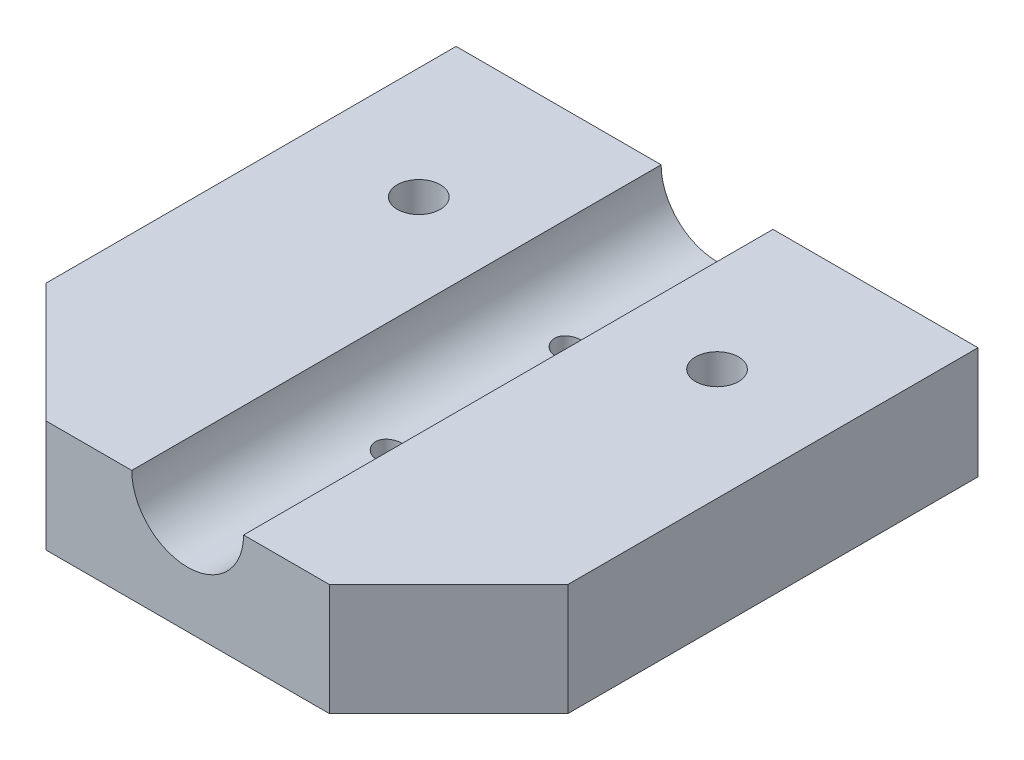
from build123d import *

# Parameters (mm, degrees)
SKETCH1_W                                      = 44.45
SKETCH1_H                                      = 45.085
BOSS_EXTRUDE1_DEPTH                            = 9.525
SKETCH4_R                                      = 4.7625
CUT_EXTRUDE1_DEPTH                             = 52.159881499
MOTORHOLES_D                                   = 2.2606
MOTORHOLES_DEPTH                               = 6.35
MOTORHOLES_TIP                                 = 0.679152758
CBORE_FOR_6_SOCKET_HEAD_CAP_SCREW1_D           = 3.6576
CBORE_FOR_6_SOCKET_HEAD_CAP_SCREW1_CBORE_D     = 7.14502
CBORE_FOR_6_SOCKET_HEAD_CAP_SCREW1_CBORE_DEPTH = 3.5052
CHAMFER1_SIZE                                  = 10.16
F_4_40_TAPPED_HOLE1_D                          = 2.2606


with BuildPart() as part:
    # Sketch1 → Boss-Extrude1 (new body)
    with BuildSketch(Plane(origin=(0, 0, 0), x_dir=(1, 0, 0), z_dir=(0, 1, 0))):
        Rectangle(SKETCH1_W, SKETCH1_H)
    extrude(amount=BOSS_EXTRUDE1_DEPTH)

    # Sketch4 → Cut-Extrude1 (cut, through all)
    with BuildSketch(Plane.XY.offset(22.5425)):
        with Locations((0, 9.525)):
            Circle(SKETCH4_R)
    extrude(amount=-CUT_EXTRUDE1_DEPTH, mode=Mode.SUBTRACT)

    # MotorHoles
    with Locations(Plane(origin=(0, 0, 0), x_dir=(-1, 0, 0), z_dir=(0, -1, 0))):
        with Locations((-5.715, -19.3675), (5.715, -19.3675), (13.081, 19.6469), (-13.081, 19.6469)):
            Hole(MOTORHOLES_D / 2, depth=MOTORHOLES_DEPTH)
            with Locations((0, 0, -(MOTORHOLES_DEPTH + MOTORHOLES_TIP / 2))):  # 118° drill point
                Cone(0, MOTORHOLES_D / 2, MOTORHOLES_TIP, mode=Mode.SUBTRACT)

    # CBORE for #6 Socket Head Cap Screw1 (through all)
    with Locations(Plane(origin=(0, 0, 0), x_dir=(-1, 0, 0), z_dir=(0, -1, 0))):
        with Locations((-12.7, 9.8425), (12.7, 9.8425)):
            CounterBoreHole(CBORE_FOR_6_SOCKET_HEAD_CAP_SCREW1_D / 2, CBORE_FOR_6_SOCKET_HEAD_CAP_SCREW1_CBORE_D / 2, CBORE_FOR_6_SOCKET_HEAD_CAP_SCREW1_CBORE_DEPTH)

    # Chamfer1
    chamfer1_edges = [part.edges().sort_by_distance(p)[0] for p in [
        (22.225, 4.7625, 22.5425),
        (-22.225, 4.7625, 22.5425),
    ]]
    chamfer(chamfer1_edges, length=CHAMFER1_SIZE)

    # #4-40 Tapped Hole1 (through all)
    with Locations(Plane(origin=(0, 0, 0), x_dir=(-1, 0, 0), z_dir=(0, -1, 0))):
        with Locations((0, 9.8425), (0, -5.3975)):
            Hole(F_4_40_TAPPED_HOLE1_D / 2)


solid = part.part
